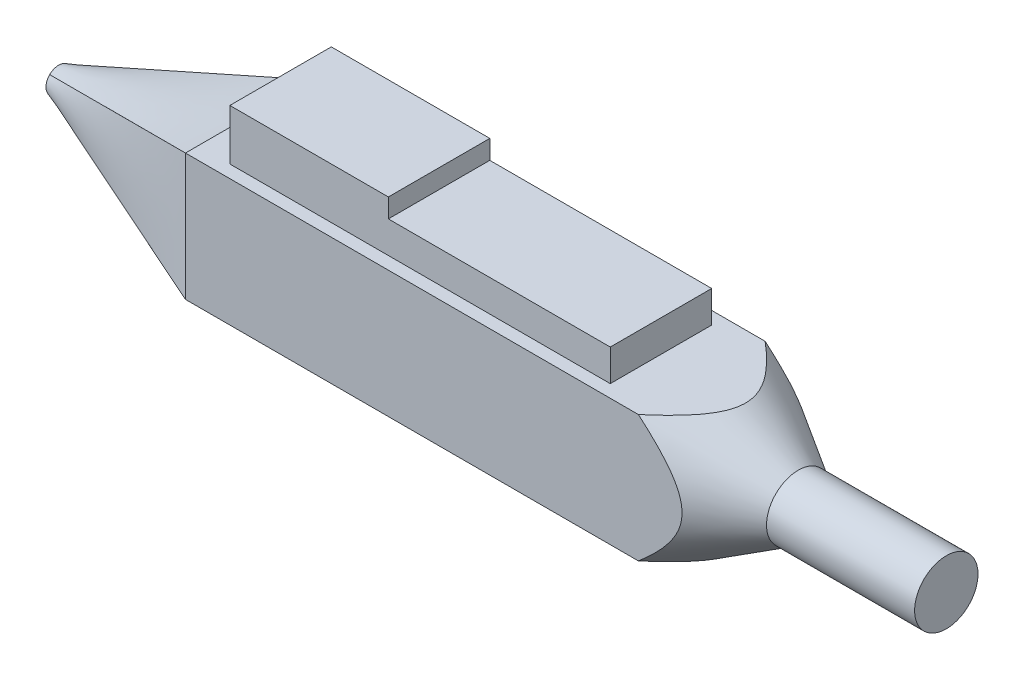
from build123d import *

# Parameters (mm, degrees)
DODANIE_WYCI_GNI_CIE1_DEPTH      = 10
DODANIE_WYCI_GNI_CIE1_DEPTH_BACK = 10
SZKIC1_W                         = 70
SZKIC1_H                         = 20
SZKIC4_R                         = 5
DODANIE_WYCI_GNI_CIE2_DEPTH      = 40
SFAZOWANIE1_SIZE                 = 10
SFAZOWANIE1_SIZE_2               = 16.642794824
SZKIC5_W                         = 60
SZKIC5_H                         = 16
DODANIE_WYCI_GNI_CIE3_DEPTH      = 5
SZKIC6_W                         = 25
SZKIC6_H                         = 16
DODANIE_WYCI_GNI_CIE4_DEPTH      = 3


with BuildPart() as part:
    # Szkic1 → Dodanie-wyciągnięcie1 (new, two sides: drawn at the far end of the back side and taken through both)
    with BuildSketch(Plane.XY.offset(-DODANIE_WYCI_GNI_CIE1_DEPTH_BACK)):
        Rectangle(SZKIC1_W, SZKIC1_H)
    extrude(amount=DODANIE_WYCI_GNI_CIE1_DEPTH + DODANIE_WYCI_GNI_CIE1_DEPTH_BACK)

    # Wyciągnięcie po profilach1: read off the stored shape, not the designer's step
    # Wyciągnięcie po profilach1: loft between two sections, ruled curve by curve
    wyci_gni_cie_po_profilach1_from = [
        Edge.make_bspline([(-65, 1.414213562, -1.414213562), (-65, 1.580880229, -1.247546896), (-65, 1.730317192, -1.037358885), (-65, 1.94065032, -0.551350505), (-65, 2, -0.276142375), (-65, 2, 0.276142375), (-65, 1.94065032, 0.551350505), (-65, 1.730317192, 1.037358885), (-65, 1.580880229, 1.247546896), (-65, 1.414213562, 1.414213562)], [0, 0, 0, 0, 0.25, 0.25, 0.5, 0.5, 0.75, 0.75, 1, 1, 1, 1], 3),
        Edge.make_bspline([(-65, 1.414213562, 1.414213562), (-65, 1.247546896, 1.580880229), (-65, 1.037358885, 1.730317192), (-65, 0.551350505, 1.94065032), (-65, 0.276142375, 2), (-65, -0.276142375, 2), (-65, -0.551350505, 1.94065032), (-65, -1.037358885, 1.730317192), (-65, -1.247546896, 1.580880229), (-65, -1.414213562, 1.414213562)], [0, 0, 0, 0, 0.25, 0.25, 0.5, 0.5, 0.75, 0.75, 1, 1, 1, 1], 3),
        Edge.make_bspline([(-65, -1.414213562, -1.414213562), (-65, -1.247546896, -1.580880229), (-65, -1.037358885, -1.730317192), (-65, -0.551350505, -1.94065032), (-65, -0.276142375, -2), (-65, 0.276142375, -2), (-65, 0.551350505, -1.94065032), (-65, 1.037358885, -1.730317192), (-65, 1.247546896, -1.580880229), (-65, 1.414213562, -1.414213562)], [0, 0, 0, 0, 0.25, 0.25, 0.5, 0.5, 0.75, 0.75, 1, 1, 1, 1], 3),
        Edge.make_bspline([(-65, -1.414213562, 1.414213562), (-65, -1.580880229, 1.247546896), (-65, -1.730317192, 1.037358885), (-65, -1.94065032, 0.551350505), (-65, -2, 0.276142375), (-65, -2, -0.276142375), (-65, -1.94065032, -0.551350505), (-65, -1.730317192, -1.037358885), (-65, -1.580880229, -1.247546896), (-65, -1.414213562, -1.414213562)], [0, 0, 0, 0, 0.25, 0.25, 0.5, 0.5, 0.75, 0.75, 1, 1, 1, 1], 3),
    ]
    wyci_gni_cie_po_profilach1_to = [
        Edge.make_bspline([(-35, 10, -10), (-35, 10, -8.333333333), (-35, 10, -6.666666667), (-35, 10, -3.333333333), (-35, 10, -1.666666667), (-35, 10, 1.666666667), (-35, 10, 3.333333333), (-35, 10, 6.666666667), (-35, 10, 8.333333333), (-35, 10, 10)], [0, 0, 0, 0, 0.25, 0.25, 0.5, 0.5, 0.75, 0.75, 1, 1, 1, 1], 3),
        Edge.make_bspline([(-35, 10, 10), (-35, 8.333333333, 10), (-35, 6.666666667, 10), (-35, 3.333333333, 10), (-35, 1.666666667, 10), (-35, -1.666666667, 10), (-35, -3.333333333, 10), (-35, -6.666666667, 10), (-35, -8.333333333, 10), (-35, -10, 10)], [0, 0, 0, 0, 0.25, 0.25, 0.5, 0.5, 0.75, 0.75, 1, 1, 1, 1], 3),
        Edge.make_bspline([(-35, -10, -10), (-35, -8.333333333, -10), (-35, -6.666666667, -10), (-35, -3.333333333, -10), (-35, -1.666666667, -10), (-35, 1.666666667, -10), (-35, 3.333333333, -10), (-35, 6.666666667, -10), (-35, 8.333333333, -10), (-35, 10, -10)], [0, 0, 0, 0, 0.25, 0.25, 0.5, 0.5, 0.75, 0.75, 1, 1, 1, 1], 3),
        Edge.make_bspline([(-35, -10, 10), (-35, -10, 8.333333333), (-35, -10, 6.666666667), (-35, -10, 3.333333333), (-35, -10, 1.666666667), (-35, -10, -1.666666667), (-35, -10, -3.333333333), (-35, -10, -6.666666667), (-35, -10, -8.333333333), (-35, -10, -10)], [0, 0, 0, 0, 0.25, 0.25, 0.5, 0.5, 0.75, 0.75, 1, 1, 1, 1], 3),
    ]
    wyci_gni_cie_po_profilach1 = Solid(Shell([*[Face.make_surface_from_curves(wyci_gni_cie_po_profilach1_from[k], wyci_gni_cie_po_profilach1_to[k]) for k in range(4)], Face(Wire(wyci_gni_cie_po_profilach1_from)), Face(Wire(wyci_gni_cie_po_profilach1_to))]))
    add(wyci_gni_cie_po_profilach1)

    # Szkic4 → Dodanie-wyciągnięcie2 (add)
    with BuildSketch(Plane(origin=(35, 0, 0), x_dir=(0, 0, -1), z_dir=(1, 0, 0))):
        Circle(SZKIC4_R)
    extrude(amount=DODANIE_WYCI_GNI_CIE2_DEPTH)

    # Sfazowanie1
    # the kernel refuses this chamfer: 16.642794824, 10 mm, written as the material it adds along each edge
    with BuildSketch(Plane(origin=(35, 0, 0), x_dir=(0, 0, -1), z_dir=(0, -1, 0))) as sfazowanie1_piece_1_section:
        Polygon((5 + SFAZOWANIE1_SIZE, 0), (5, SFAZOWANIE1_SIZE_2), (5, 0), align=None)
    sfazowanie1_piece_1 = revolve(axis=Axis((35, 0, 0), (1, 0, 0)), mode=Mode.PRIVATE)
    sfazowanie1_piece_1 = split(sfazowanie1_piece_1, bisect_by=Plane(origin=(35, 10, 0), z_dir=(0, -1, 0)), keep=Keep.TOP, mode=Mode.PRIVATE)
    sfazowanie1_piece_1 = split(sfazowanie1_piece_1, bisect_by=Plane(origin=(35, 0, 10), z_dir=(0, 0, -1)), keep=Keep.TOP, mode=Mode.PRIVATE)
    sfazowanie1_piece_1 = split(sfazowanie1_piece_1, bisect_by=Plane(origin=(35, 0, -10), z_dir=(0, 0, 1)), keep=Keep.TOP, mode=Mode.PRIVATE)
    sfazowanie1_piece_1 = split(sfazowanie1_piece_1, bisect_by=Plane(origin=(35, -10, 0), z_dir=(0, 1, 0)), keep=Keep.TOP, mode=Mode.PRIVATE)
    add(sfazowanie1_piece_1)

    # Szkic5 → Dodanie-wyciągnięcie3 (add)
    with BuildSketch(Plane(origin=(0, 10, 0), x_dir=(1, 0, 0), z_dir=(0, 1, 0))):
        Rectangle(SZKIC5_W, SZKIC5_H)
    extrude(amount=DODANIE_WYCI_GNI_CIE3_DEPTH)

    # Szkic6 → Dodanie-wyciągnięcie4 (add)
    with BuildSketch(Plane(origin=(0, 15, 0), x_dir=(1, 0, 0), z_dir=(0, 1, 0))):
        with Locations((-17.5, 0)):
            Rectangle(SZKIC6_W, SZKIC6_H)
    extrude(amount=DODANIE_WYCI_GNI_CIE4_DEPTH)


solid = part.part
